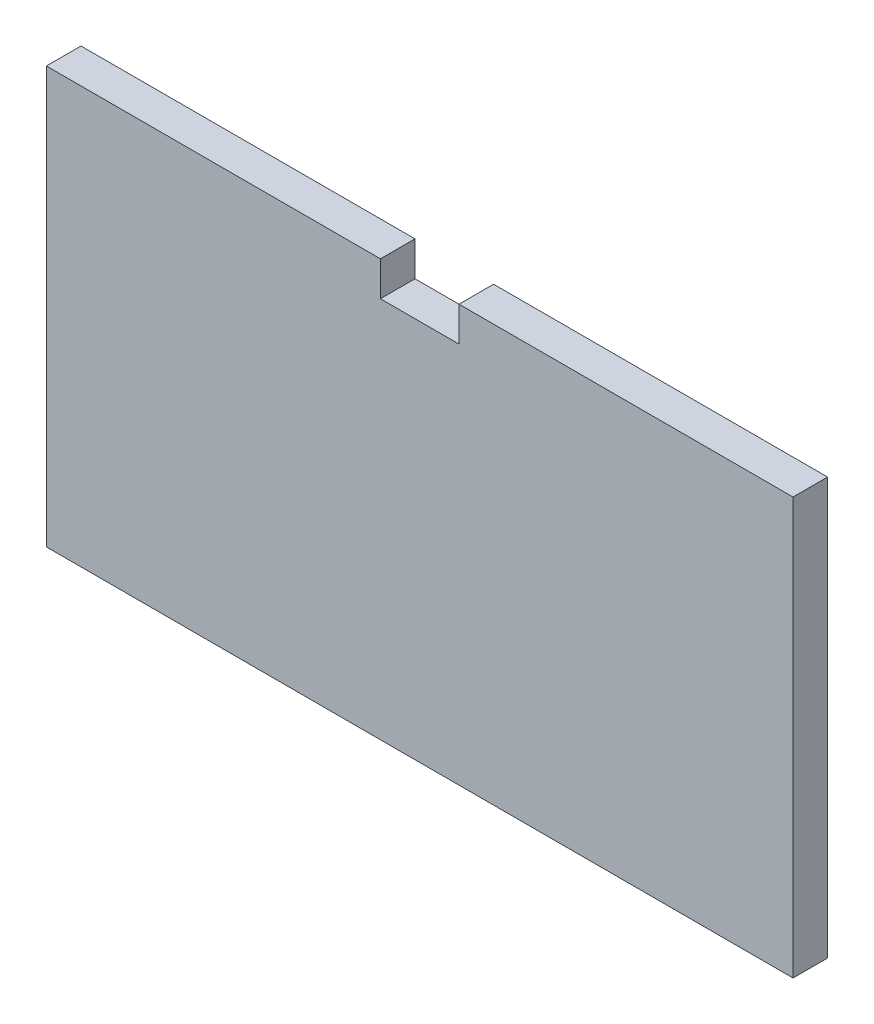
from build123d import *

# Parameters (mm, degrees)
BOSS_EXTRUDE1_DEPTH = 2.794


with BuildPart() as part:
    # Sketch1 → Boss-Extrude1 (new, symmetric)
    with BuildSketch(Plane.XY):
        Polygon((-6.35, 33.655), (-6.35, 28.067), (6.35, 28.067), (6.35, 33.655), (60.325, 33.655), (60.325, -33.655), (-60.325, -33.655), (-60.325, 33.655), align=None)
    extrude(amount=BOSS_EXTRUDE1_DEPTH, both=True)


solid = part.part
